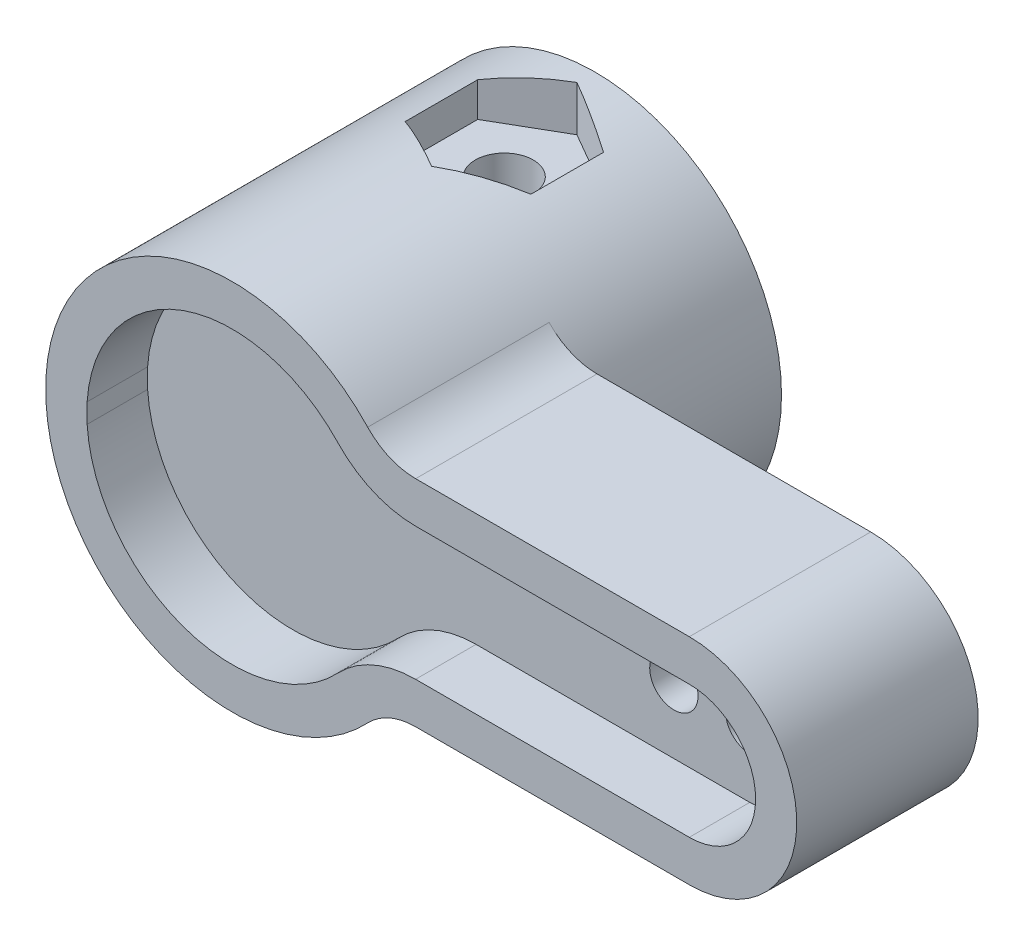
from build123d import *
from build123d.topology import SkipClean

# Parameters (mm, degrees)
BOSS_EXTRUDE3_DEPTH     = 3.175
BOSS_EXTRUDE4_START     = 6.35
BOSS_EXTRUDE4_DEPTH     = 6.35
CUT_EXTRUDE3_REACH      = 59.572
SKETCH8_R               = 1.27
BOSS_EXTRUDE5_START     = 9.525
BOSS_EXTRUDE5_DEPTH     = 9.525
CUT_EXTRUDE4_DEPTH      = 59.956491599
CUT_EXTRUDE4_DEPTH_BACK = 59.956491599
SKETCH10_R              = 1.524
SKETCH11_R              = 2.413
CUT_EXTRUDE5_DEPTH      = 2.921
CUT_EXTRUDE6_DEPTH      = 2.38125


with BuildPart() as part:
    # Sketch4 → Boss-Extrude3 (new body)
    with BuildSketch(Plane.XY):
        with BuildLine():
            ThreePointArc((31.086110699, 15.636564613), (20.623940967, 18.113222785), (14.197476081, 9.493978021))
            Line((14.197476081, 9.493978021), (14.197476081, 8.331754978))
            ThreePointArc((14.197476081, 8.331754978), (20.623940967, -0.287489785), (31.086110699, 2.189168386))
            ThreePointArc((31.086110699, 2.189168386), (32.231791551, 2.990413079), (33.601024086, 3.2728665))
            Line((33.601024086, 3.2728665), (47.970214151, 3.2728665))
            ThreePointArc((47.970214151, 3.2728665), (53.610214151, 8.9128665), (47.970214151, 14.5528665))
            Line((47.970214151, 14.5528665), (33.601024086, 14.5528665))
            ThreePointArc((33.601024086, 14.5528665), (32.231791551, 14.83531992), (31.086110699, 15.636564613))
        make_face()
        with BuildLine():
            Line((16.356476081, 8.399881519), (16.356476081, 9.42585148))
            ThreePointArc((16.356476081, 9.42585148), (21.390181021, 16.094481224), (29.51683382, 14.153779707))
            ThreePointArc((29.51683382, 14.153779707), (31.377406278, 12.852567589), (33.601024086, 12.3938665))
            Line((33.601024086, 12.3938665), (47.970214151, 12.3938665))
            ThreePointArc((47.970214151, 12.3938665), (51.451214151, 8.9128665), (47.970214151, 5.4318665))
            Line((47.970214151, 5.4318665), (33.601024086, 5.4318665))
            ThreePointArc((33.601024086, 5.4318665), (31.377406278, 4.97316541), (29.51683382, 3.671953292))
            ThreePointArc((29.51683382, 3.671953292), (21.390181021, 1.731251775), (16.356476081, 8.399881519))
        make_face(mode=Mode.SUBTRACT)
    extrude(amount=BOSS_EXTRUDE3_DEPTH)

    # Sketch5 → Boss-Extrude4 (add)
    with BuildSketch(Plane(origin=(0, 0, 0), x_dir=(-1, 0, 0), z_dir=(0, 0, -1)).offset(BOSS_EXTRUDE4_START)):
        with BuildLine():
            Line((-33.601024086, 14.5528665), (-47.970214151, 14.5528665))
            ThreePointArc((-47.970214151, 14.5528665), (-53.610214151, 8.9128665), (-47.970214151, 3.2728665))
            Line((-47.970214151, 3.2728665), (-33.601024086, 3.2728665))
            ThreePointArc((-33.601024086, 3.2728665), (-32.231791551, 2.990413079), (-31.086110699, 2.189168386))
            ThreePointArc((-31.086110699, 2.189168386), (-20.623940967, -0.287489785), (-14.197476081, 8.331754978))
            Line((-14.197476081, 8.331754978), (-14.197476081, 9.493978021))
            ThreePointArc((-14.197476081, 9.493978021), (-20.623940967, 18.113222785), (-31.086110699, 15.636564613))
            ThreePointArc((-31.086110699, 15.636564613), (-32.231791551, 14.83531992), (-33.601024086, 14.5528665))
        make_face()
    extrude(amount=-BOSS_EXTRUDE4_DEPTH)

    # Sketch8 → Cut-Extrude3 (cut, up to next)
    with BuildSketch(Plane(origin=(0, 0, -6.35), x_dir=(-1, 0, 0), z_dir=(0, 0, -1)), mode=Mode.PRIVATE) as cut_extrude3_sk1:
        with Locations((-47.973214151, 8.9128665)):
            Circle(SKETCH8_R)
    cut_extrude3_tool1 = extrude(cut_extrude3_sk1.sketch, amount=-CUT_EXTRUDE3_REACH, mode=Mode.PRIVATE) & part.part
    # Sketch8 → Cut-Extrude3 (cut, up to next)
    with BuildSketch(Plane(origin=(0, 0, -6.35), x_dir=(-1, 0, 0), z_dir=(0, 0, -1)), mode=Mode.PRIVATE) as cut_extrude3_sk2:
        with Locations((-43.985414151, 8.9128665)):
            Circle(SKETCH8_R)
    cut_extrude3_tool2 = extrude(cut_extrude3_sk2.sketch, amount=-CUT_EXTRUDE3_REACH, mode=Mode.PRIVATE) & part.part
    add(cut_extrude3_tool1.solids().sort_by_distance((47.973214, 8.912866, -6.35))[0], mode=Mode.SUBTRACT)
    add(cut_extrude3_tool2.solids().sort_by_distance((43.985414, 8.912866, -6.35))[0], mode=Mode.SUBTRACT)

    # Sketch9 → Boss-Extrude5 (add)
    with BuildSketch(Plane(origin=(0, 0, -6.35), x_dir=(-1, 0, 0), z_dir=(0, 0, -1)).offset(BOSS_EXTRUDE5_START)):
        with BuildLine():
            Line((-14.197476081, 8.331754978), (-14.197476081, 9.493978021))
            ThreePointArc((-14.197476081, 9.493978021), (-33.760214151, 8.9128665), (-14.197476081, 8.331754978))
        make_face()
        with BuildLine():
            ThreePointArc((-18.350464151, 5.822333829), (-19.43518481, 4.377837158), (-20.879681481, 3.2931165))
            Line((-20.879681481, 3.2931165), (-27.060746822, 3.2931165))
            ThreePointArc((-27.060746822, 3.2931165), (-28.505243493, 4.377837158), (-29.589964151, 5.822333829))
            Line((-29.589964151, 5.822333829), (-29.589964151, 12.00339917))
            ThreePointArc((-29.589964151, 12.00339917), (-28.505243493, 13.447895841), (-27.060746822, 14.5326165))
            Line((-27.060746822, 14.5326165), (-20.879681481, 14.5326165))
            ThreePointArc((-20.879681481, 14.5326165), (-19.43518481, 13.447895841), (-18.350464151, 12.00339917))
            Line((-18.350464151, 12.00339917), (-18.350464151, 5.822333829))
        make_face(mode=Mode.SUBTRACT)
    extrude(amount=-BOSS_EXTRUDE5_DEPTH)

    # Sketch10 → Cut-Extrude4 (cut, two sides: drawn at the far end of the back side and taken through both)
    with BuildSketch(Plane(origin=(0, 0, 0), x_dir=(1, 0, 0), z_dir=(0, 1, 0)).offset(-CUT_EXTRUDE4_DEPTH_BACK)):
        with Locations((23.970214151, 11.1125)):
            Circle(SKETCH10_R)
    extrude(amount=CUT_EXTRUDE4_DEPTH + CUT_EXTRUDE4_DEPTH_BACK, mode=Mode.SUBTRACT)

    # Sketch11 → Cut-Extrude5 (cut)
    with SkipClean():  # the faces are left unmerged after this step: merging them gives an invalid solid
        with BuildSketch(Plane(origin=(0, -0.8771335, 0), x_dir=(-1, 0, 0), z_dir=(0, -1, 0))):
            with Locations((-23.970214151, 11.1125)):
                Circle(SKETCH11_R)
        extrude(amount=-CUT_EXTRUDE5_DEPTH, mode=Mode.SUBTRACT)

    # Sketch12 → Cut-Extrude6 (cut)
    with SkipClean():  # the faces are left unmerged after this step: merging them gives an invalid solid
        with BuildSketch(Plane(origin=(0, 18.7028665, 0), x_dir=(1, 0, 0), z_dir=(0, 1, 0))):
            Polygon((27.272214151, 9.206089411), (27.272214151, 13.018910589), (23.970214151, 14.925321178), (20.668214151, 13.018910589), (20.668214151, 9.206089411), (23.970214151, 7.299678822), align=None)
        extrude(amount=-CUT_EXTRUDE6_DEPTH, mode=Mode.SUBTRACT)


solid = part.part
